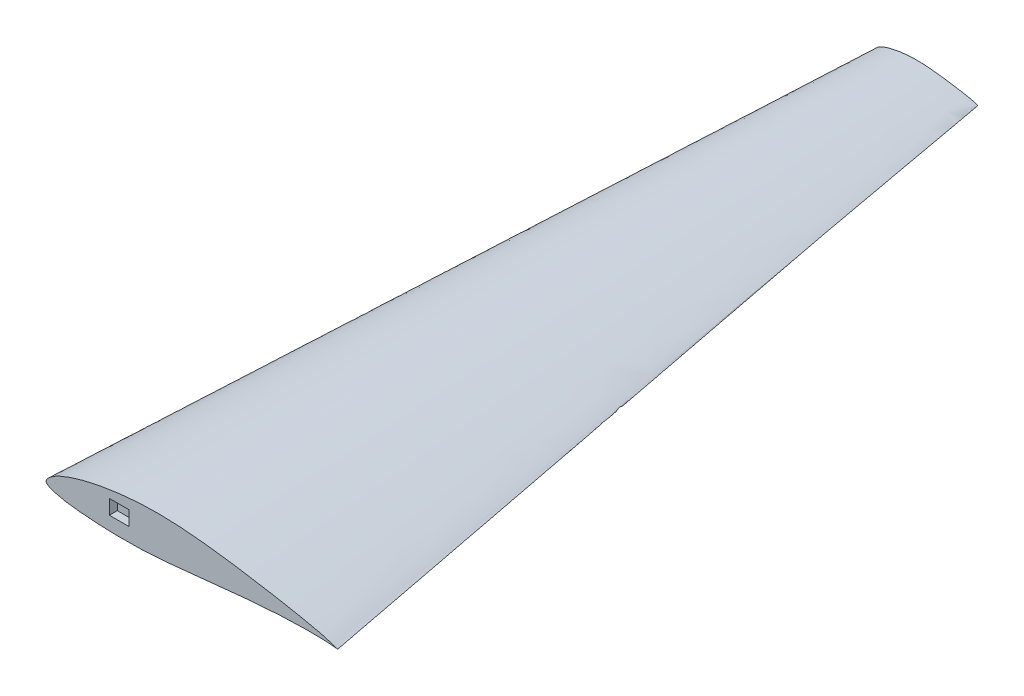
from build123d import *

# Parameters (mm, degrees)
SKETCH9_W           = 153.025181843
SKETCH9_H           = 114.223926853
BOSS_EXTRUDE1_DEPTH = 30
SKETCH10_W          = 3736.04637994
SKETCH10_H          = 1750.840031194
CUT_EXTRUDE1_DEPTH  = 6202
SKETCH12_W          = 153.025181843
SKETCH12_H          = 114.223926853
CUT_EXTRUDE2_DEPTH  = 120


with BuildPart() as part:
    # Loft5: read off the stored shape, not the designer's step
    # Loft5: loft between two sections, ruled curve by curve
    loft5_from = [
        Edge.make_bspline([(-829.212772497, 127.551706357, 0), (-831.317274891, 127.061718607, 0), (-844.668148264, 123.928740686, 0), (-872.329771939, 117.109052219, 0), (-906.646678697, 107.793584513, 0), (-943.80675307, 96.706282111, 0), (-972.975630231, 87.133596036, 0), (-1007.056661139, 74.800467806, 0), (-1030.665167222, 65.371687304, 0), (-1061.251311385, 51.696229701, 0), (-1079.007221144, 42.808632271, 0), (-1104.056348403, 28.406825452, 0), (-1117.409319776, 19.763642688, 0), (-1135.661709212, 5.372212741, 0), (-1144.515334401, -2.76604107, 0), (-1152.824664261, -12.775534115, 0), (-1156.436856109, -17.898520897, 0), (-1159.789487128, -23.909048657, 0), (-1161.961165575, -29.098752305, 0), (-1162.898772566, -33.888692217, 0), (-1162.722322656, -37.246430416, 0), (-1161.376410185, -40.405163539, 0), (-1159.101061336, -43.341445224, 0), (-1156.169648214, -46.360268456, 0), (-1153.913610018, -48.325076325, 0), (-1149.037863286, -52.229824068, 0), (-1144.904465379, -54.873739693, 0), (-1138.918168667, -58.2614101, 0), (-1135.409125373, -60.114894418, 0), (-1131.086153496, -62.184117695, 0), (-1128.062749348, -63.552116154, 0), (-1124.957966743, -64.902605897, 0), (-1121.733410812, -66.233544346, 0), (-1117.820438188, -67.774740949, 0), (-1110.816309962, -70.417875078, 0), (-1097.913469259, -74.794649303, 0), (-1085.242602625, -78.392314228, 0), (-1064.043847197, -83.894313067, 0), (-1047.315496568, -87.539615236, 0), (-1017.117187521, -93.260495205, 0), (-994.512717815, -96.924455589, 0), (-959.517300941, -101.820414141, 0), (-930.120025114, -105.403442174, 0), (-891.724704525, -109.432084325, 0), (-856.001094532, -112.660371668, 0), (-814.532681306, -115.819272508, 0), (-773.108617956, -118.46019236, 0), (-728.921749645, -120.727861062, 0), (-682.487865336, -122.589459116, 0), (-635.955138153, -123.896306526, 0), (-585.260805311, -124.716877102, 0), (-536.786168999, -124.870489109, 0), (-482.492900731, -124.307536975, 0), (-432.360602341, -123.075537446, 0), (-374.939789857, -120.848489139, 0), (-323.370046071, -118.090444143, 0), (-263.150854917, -113.99486438, 0), (-210.284693563, -109.672068592, 0), (-147.384354845, -103.796961064, 0), (-93.209248624, -98.245085126, 0), (-27.830451447, -91.283325291, 0), (27.454015847, -85.244242969, 0), (94.536215974, -77.893849451, 0), (150.39908442, -71.81267181, 0), (218.052527081, -64.624948902, 0), (273.920887846, -58.869058971, 0), (340.938588876, -52.252940051, 0), (396.199038728, -47.078911228, 0), (461.320625474, -41.411227612, 0), (515.337224218, -37.086128159, 0), (577.258841301, -32.619053172, 0), (629.366984439, -29.282013497, 0), (686.772059362, -26.121169414, 0), (736.32883914, -23.863508643, 0), (788.002218715, -22.08100638, 0), (834.381396591, -20.969016588, 0), (878.996349976, -20.394696271, 0), (921.647415287, -20.369424901, 0), (958.504069283, -20.876496332, 0), (996.654106057, -21.799806632, 0), (1023.598056722, -22.716367439, 0), (1057.024719476, -24.623742059, 0), (1077.499981305, -26.264632795, 0), (1096.514340268, -27.566782518, 0), (1105.67791724, -28.280245159, 0), (1126.629467928, -31.787482376, 0), (1116.860258711, -29.204675117, 0), (1103.491455609, -25.345372413, 0), (1097.045245428, -22.784584734, 0), (1087.42865464, -19.254695703, 0), (1081.046641164, -16.983065882, 0), (1071.065638587, -13.548629979, 0), (1060.508198045, -10.056396018, 0), (1041.501846956, -4.011755255, 0), (1027.267729689, 0.144425406, 0), (1001.62865514, 7.087391456, 0), (982.966051304, 11.664428987, 0), (950.144604936, 19.245814605, 0), (924.339173662, 24.953084517, 0), (887.987857285, 32.691699437, 0), (855.221667661, 39.456253619, 0), (815.432732419, 47.436061284, 0), (776.394699371, 55.078042811, 0), (733.635824341, 63.242248164, 0), (689.09132049, 71.554958692, 0), (643.736426124, 79.820771828, 0), (594.501021823, 88.597113467, 0), (546.979513719, 96.853397495, 0), (493.926468036, 105.814553336, 0), (444.688425496, 113.877854678, 0), (388.704102795, 122.751431019, 0), (338.176625069, 130.462695339, 0), (280.153653465, 138.938776244, 0), (228.796399932, 146.066997244, 0), (169.620247767, 153.793957674, 0), (117.8495197, 160.094803785, 0), (58.371499933, 166.752946042, 0), (6.613894095, 171.982487207, 0), (-52.350409868, 177.19161356, 0), (-103.707599495, 180.989927105, 0), (-161.504174793, 184.272167029, 0), (-212.18503492, 186.250098279, 0), (-268.376964457, 187.366353469, 0), (-318.189108737, 187.369099053, 0), (-372.466520975, 186.211013679, 0), (-421.229723555, 184.136770997, 0), (-473.348885587, 180.784630174, 0), (-520.928345689, 176.749110039, 0), (-570.605287005, 171.553982266, 0), (-616.78200539, 165.855506715, 0), (-663.514068565, 159.219359753, 0), (-707.942171735, 152.063883731, 0), (-751.094306198, 144.229303286, 0), (-791.304100998, 136.103996798, 0), (-816.926871374, 130.412212037, 0), (-829.212772497, 127.551706357, 0)], [0, 0, 0, 0, 0.001389313, 0.008817328, 0.018317328, 0.024249235, 0.033749235, 0.038050758, 0.047550758, 0.050086992, 0.059586992, 0.060298396, 0.068662508, 0.069798396, 0.075196821, 0.076355027, 0.078162508, 0.079210607, 0.080771243, 0.081759988, 0.082324933, 0.082903368, 0.083935007, 0.084696821, 0.08560475, 0.085855027, 0.088710607, 0.088745281, 0.090271243, 0.091259988, 0.091824933, 0.092403368, 0.093435007, 0.094065408, 0.09510475, 0.098245281, 0.102821682, 0.103565408, 0.112321682, 0.113824926, 0.123324926, 0.127043205, 0.136543205, 0.142365824, 0.151865824, 0.159606169, 0.169106169, 0.178554979, 0.188054979, 0.198986583, 0.208486583, 0.220654823, 0.230154823, 0.243397979, 0.252897979, 0.267102846, 0.276602846, 0.291707475, 0.301207475, 0.317224202, 0.326724202, 0.343484356, 0.352984356, 0.370117039, 0.379617039, 0.3967311, 0.4062311, 0.422919301, 0.432419301, 0.448263223, 0.457763223, 0.472337171, 0.481837171, 0.494734876, 0.504234876, 0.515067169, 0.524567169, 0.532973464, 0.542473464, 0.548115275, 0.557615275, 0.560239006, 0.569117917, 0.569739006, 0.574561052, 0.5764, 0.578180254, 0.578617917, 0.583176619, 0.584061052, 0.5859, 0.587680254, 0.590707632, 0.592676619, 0.600207632, 0.600446247, 0.609946247, 0.612516403, 0.622016403, 0.626946973, 0.636446973, 0.643529884, 0.653029884, 0.662024429, 0.671524429, 0.682167292, 0.691667292, 0.703682098, 0.713182098, 0.726264114, 0.735764114, 0.74962976, 0.75912976, 0.773469078, 0.782969078, 0.797503034, 0.807003034, 0.821451957, 0.830951957, 0.84506318, 0.85456318, 0.868172798, 0.877672798, 0.890698508, 0.900198508, 0.912577511, 0.922077511, 0.933777359, 0.943277359, 0.95419167, 0.96369167, 0.973624888, 0.983124888, 0.991889313, 1, 1, 1, 1], 3),
    ]
    loft5_to = [
        Edge.make_bspline([(-729.582389456, 13.403805311, 6200), (-730.318211722, 13.238348565, 6200), (-734.98649761, 12.180942787, 6200), (-744.66247192, 9.886964265, 6200), (-756.675221699, 6.770524912, 6200), (-769.701597857, 3.093513865, 6200), (-779.941039136, -0.05877316, 6200), (-791.937939175, -4.073504277, 6200), (-800.271635923, -7.114097709, 6200), (-811.137073166, -11.433971487, 6200), (-817.485959529, -14.19456714, 6200), (-826.581899049, -18.557067843, 6200), (-831.501072742, -21.127209764, 6200), (-838.462484808, -25.246287729, 6200), (-841.975859972, -27.509371787, 6200), (-845.654984774, -30.176591122, 6200), (-847.387479055, -31.504072044, 6200), (-849.254612158, -33.019459167, 6200), (-850.738397936, -34.299081324, 6200), (-851.981208618, -35.450593648, 6200), (-852.81195744, -36.258654397, 6200), (-853.643168007, -37.098398304, 6200), (-854.522834035, -38.038824986, 6200), (-855.486598587, -39.143425162, 6200), (-856.144369435, -39.951804386, 6200), (-857.470291301, -41.682556994, 6200), (-858.399044101, -43.126554736, 6200), (-859.437447764, -45.292435097, 6200), (-859.951652512, -46.585094986, 6200), (-860.250483794, -48.243008279, 6200), (-860.171358916, -49.413931298, 6200), (-859.685133378, -50.509291448, 6200), (-858.920544702, -51.46604271, 6200), (-857.890282721, -52.51274062, 6200), (-855.899412614, -54.210877329, 6200), (-851.845410917, -56.738617721, 6200), (-847.631826927, -58.591481927, 6200), (-840.476286073, -61.294767411, 6200), (-834.724461756, -62.945601924, 6200), (-824.291101711, -65.451606173, 6200), (-816.441328873, -66.973721147, 6200), (-804.264962227, -68.934536156, 6200), (-794.016105144, -70.292979192, 6200), (-780.624231997, -71.788910349, 6200), (-768.15823144, -72.952015434, 6200), (-753.685229768, -74.065867066, 6200), (-739.225029965, -74.968204536, 6200), (-723.800256947, -75.720503999, 6200), (-707.59066002, -76.309738655, 6200), (-691.347393324, -76.703765359, 6200), (-673.652310294, -76.920958508, 6200), (-656.732725681, -76.915239558, 6200), (-637.783141412, -76.660005077, 6200), (-620.28657042, -76.175627428, 6200), (-600.247094685, -75.335952801, 6200), (-582.250512499, -74.314957468, 6200), (-561.236484634, -72.814658427, 6200), (-542.791640178, -71.218916422, 6200), (-520.849100672, -69.035328801, 6200), (-501.958483833, -66.92672383, 6200), (-479.169318703, -64.222617868, 6200), (-459.902845381, -61.856842079, 6200), (-436.529026608, -58.946691598, 6200), (-417.066692699, -56.516875483, 6200), (-393.498661069, -53.611404802, 6200), (-374.03645908, -51.263140683, 6200), (-350.690306424, -48.532951986, 6200), (-331.439751589, -46.363488637, 6200), (-308.753293046, -43.93747608, 6200), (-289.934159161, -42.045489335, 6200), (-268.359116036, -40.035462323, 6200), (-250.199918116, -38.480736838, 6200), (-230.190766005, -36.936212469, 6200), (-212.91889373, -35.747522114, 6200), (-194.910643233, -34.687055333, 6200), (-178.727987445, -33.896785804, 6200), (-163.142037505, -33.300869727, 6200), (-148.295180486, -32.878505974, 6200), (-135.510280925, -32.668243988, 6200), (-122.064312898, -32.610547727, 6200), (-112.41237929, -32.676095179, 6200), (-101.185621164, -32.839242744, 6200), (-94.694191826, -33.009619549, 6200), (-86.646997526, -33.381934733, 6200), (-82.437547294, -33.623039531, 6200), (-77.887637836, -33.892326878, 6200), (-75.836489586, -34.010750741, 6200), (-72.598003768, -34.189053211, 6200), (-70.178258635, -34.301668596, 6200), (-65.130926277, -34.952280468, 6200), (-61.219968316, -35.546922275, 6200), (-66.827943541, -34.153745823, 6200), (-70.308987126, -33.04414093, 6200), (-75.598263023, -31.116558633, 6200), (-81.045792296, -29.345647125, 6200), (-90.319570234, -26.507163426, 6200), (-96.595904047, -24.750384373, 6200), (-107.88502428, -21.957778239, 6200), (-116.957770808, -19.954032435, 6200), (-129.689332313, -17.290409799, 6200), (-141.121593196, -15.011777611, 6200), (-155.022712636, -12.343362224, 6200), (-168.679885661, -9.806925635, 6200), (-183.635091475, -7.108962462, 6200), (-199.211125486, -4.374114881, 6200), (-215.071766812, -1.663516138, 6200), (-232.290856731, 1.205102467, 6200), (-248.908737025, 3.903029265, 6200), (-267.458845846, 6.830098193, 6200), (-284.67394302, 9.459710916, 6200), (-304.246471706, 12.348521858, 6200), (-321.909051, 14.859760629, 6200), (-342.189067406, 17.620147222, 6200), (-360.136717598, 19.943970403, 6200), (-380.81354783, 22.464574829, 6200), (-398.900387153, 24.520166576, 6200), (-419.676785549, 26.691326162, 6200), (-437.753077169, 28.405097583, 6200), (-458.342023145, 30.120547388, 6200), (-476.271878737, 31.390704448, 6200), (-496.445788386, 32.511818091, 6200), (-514.135464419, 33.198221005, 6200), (-533.747761807, 33.602932118, 6200), (-551.134229476, 33.637210802, 6200), (-570.079752186, 33.291176346, 6200), (-587.102435635, 32.626327338, 6200), (-605.298537547, 31.527055863, 6200), (-621.909929147, 30.172193525, 6200), (-639.254057596, 28.403654796, 6200), (-655.375965402, 26.451894064, 6200), (-671.691690803, 24.168932191, 6200), (-687.207071999, 21.722041351, 6200), (-702.280533154, 19.055363782, 6200), (-716.330842904, 16.297550032, 6200), (-725.286723349, 14.369727336, 6200), (-729.582389456, 13.403805311, 6200)], [0, 0, 0, 0, 0.001389313, 0.008817328, 0.018317328, 0.024249235, 0.033749235, 0.038050758, 0.047550758, 0.050086992, 0.059586992, 0.060298396, 0.068662508, 0.069798396, 0.075196821, 0.076355027, 0.078162508, 0.079210607, 0.080771243, 0.081759988, 0.082324933, 0.082903368, 0.083935007, 0.084696821, 0.08560475, 0.085855027, 0.088710607, 0.088745281, 0.090271243, 0.091259988, 0.091824933, 0.092403368, 0.093435007, 0.094065408, 0.09510475, 0.098245281, 0.102821682, 0.103565408, 0.112321682, 0.113824926, 0.123324926, 0.127043205, 0.136543205, 0.142365824, 0.151865824, 0.159606169, 0.169106169, 0.178554979, 0.188054979, 0.198986583, 0.208486583, 0.220654823, 0.230154823, 0.243397979, 0.252897979, 0.267102846, 0.276602846, 0.291707475, 0.301207475, 0.317224202, 0.326724202, 0.343484356, 0.352984356, 0.370117039, 0.379617039, 0.3967311, 0.4062311, 0.422919301, 0.432419301, 0.448263223, 0.457763223, 0.472337171, 0.481837171, 0.494734876, 0.504234876, 0.515067169, 0.524567169, 0.532973464, 0.542473464, 0.548115275, 0.557615275, 0.560239006, 0.569117917, 0.569739006, 0.574561052, 0.5764, 0.578180254, 0.578617917, 0.583176619, 0.584061052, 0.5859, 0.587680254, 0.590707632, 0.592676619, 0.600207632, 0.600446247, 0.609946247, 0.612516403, 0.622016403, 0.626946973, 0.636446973, 0.643529884, 0.653029884, 0.662024429, 0.671524429, 0.682167292, 0.691667292, 0.703682098, 0.713182098, 0.726264114, 0.735764114, 0.74962976, 0.75912976, 0.773469078, 0.782969078, 0.797503034, 0.807003034, 0.821451957, 0.830951957, 0.84506318, 0.85456318, 0.868172798, 0.877672798, 0.890698508, 0.900198508, 0.912577511, 0.922077511, 0.933777359, 0.943277359, 0.95419167, 0.96369167, 0.973624888, 0.983124888, 0.991889313, 1, 1, 1, 1], 3),
    ]
    loft5 = Solid(Shell([*[Face.make_surface_from_curves(loft5_from[k], loft5_to[k]) for k in range(1)], Face(Wire(loft5_from)), Face(Wire(loft5_to))]))
    add(loft5)

    # Sketch9 → Boss-Extrude1 (add)
    with BuildSketch(Plane(origin=(0, 0, 0), x_dir=(-1, 0, 0), z_dir=(0, 0, -1))):
        with Locations((590.106894295, 40.833916784)):
            Rectangle(SKETCH9_W, SKETCH9_H)
    extrude(amount=BOSS_EXTRUDE1_DEPTH)

    # Mirror3: part across plane


with BuildPart() as part_1:
    add(part.part)
    add(part.part.mirror(Plane(origin=(0, 0, -30), x_dir=(1, 0, 0), z_dir=(0, 0, -1))))

    # Sketch10 → Cut-Extrude1 (cut)
    with BuildSketch(Plane.XY.offset(6200)):
        with Locations((-546.741461091, 0)):
            Rectangle(SKETCH10_W, SKETCH10_H)
    extrude(amount=-CUT_EXTRUDE1_DEPTH, mode=Mode.SUBTRACT)

    # Sketch12 → Cut-Extrude2 (cut)
    with BuildSketch(Plane.XY.offset(-2)):
        with Locations((-590.106894295, 40.833916784)):
            Rectangle(SKETCH12_W, SKETCH12_H)
    extrude(amount=-CUT_EXTRUDE2_DEPTH, mode=Mode.SUBTRACT)


solid = part_1.part
